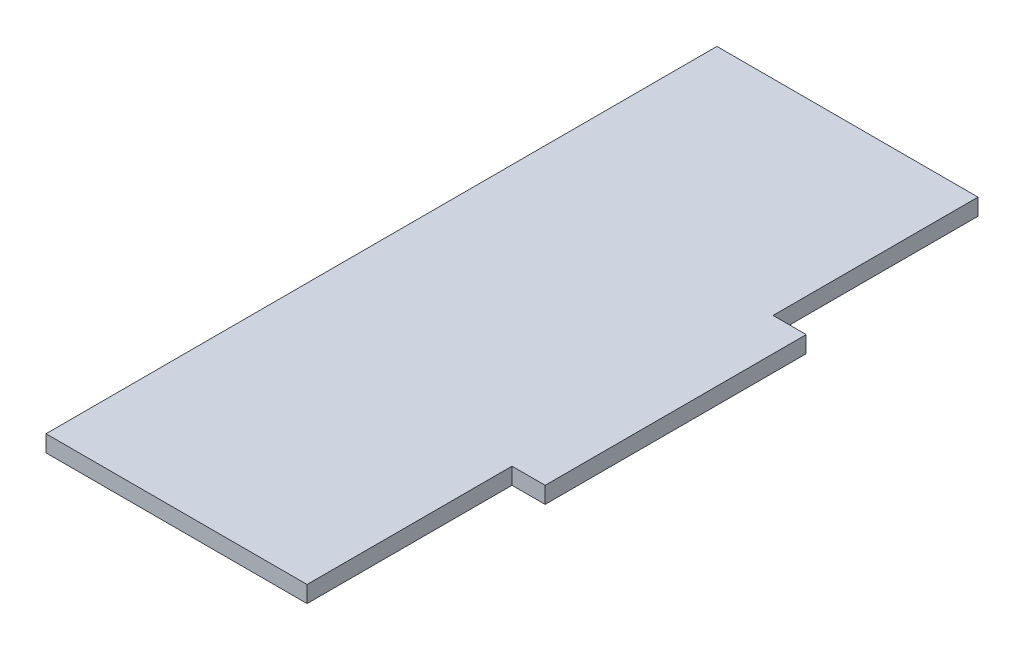
from build123d import *

# Parameters (mm, degrees)
BOSS_EXTRUDE1_DEPTH = 3.175


with BuildPart() as part:
    # Sketch1 → Boss-Extrude1 (new body)
    with BuildSketch(Plane(origin=(0, 0, 0), x_dir=(1, 0, 0), z_dir=(0, 1, 0))):
        Polygon((25, 39.25), (-25, 39.25), (-25, 0), (-25, -50), (-25, -89.25), (25, -89.25), (25, -50), (31.35, -50), (31.35, 0), (25, 0), align=None)
    extrude(amount=BOSS_EXTRUDE1_DEPTH)


solid = part.part
